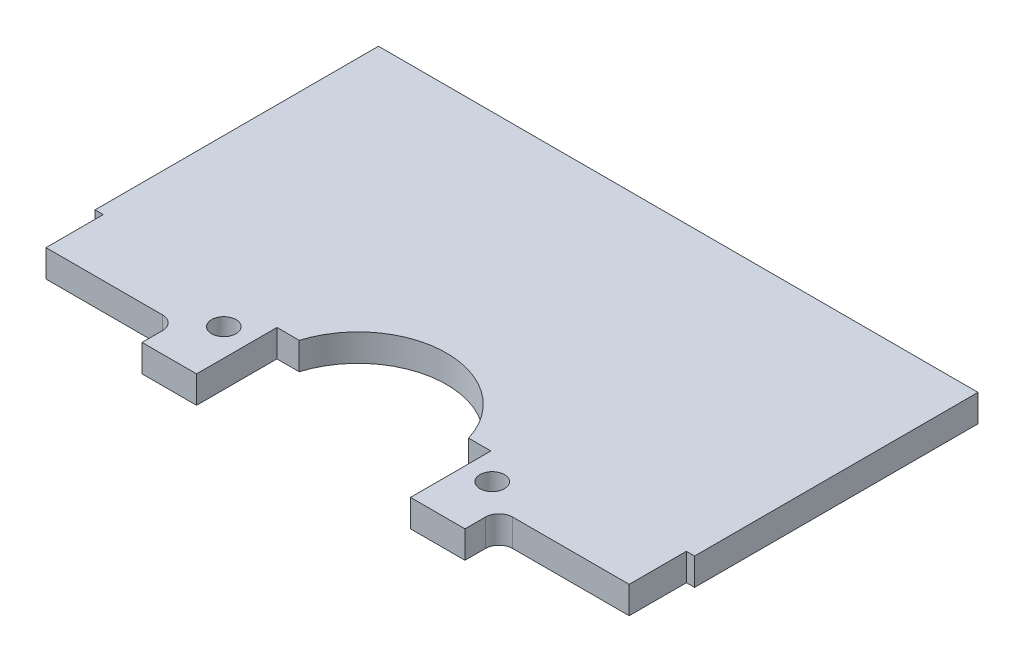
from build123d import *

# Parameters (mm, degrees)
SKETCH1_R           = 1.143
BOSS_EXTRUDE1_DEPTH = 2.54
FILLET1_R           = 1.27


with BuildPart() as part:
    # Sketch1 → Boss-Extrude1 (new body)
    with BuildSketch(Plane(origin=(0, 0, 0), x_dir=(1, 0, 0), z_dir=(0, 1, 0))):
        with BuildLine():
            Line((-27.94, 13.208), (-27.94, -13.208))
            Line((-27.94, -13.208), (-27.178, -13.208))
            Line((-27.178, -13.208), (-27.178, -18.542))
            Line((-27.178, -18.542), (-15.0495, -18.542))
            Line((-15.0495, -18.542), (-15.0495, -21.717))
            Line((-15.0495, -21.717), (-9.9695, -21.717))
            Line((-9.9695, -21.717), (-9.9695, -14.224))
            Line((-9.9695, -14.224), (-7.894457296, -14.224))
            ThreePointArc((-7.894457296, -14.224), (0, -8.382), (7.894457296, -14.224))
            Line((7.894457296, -14.224), (9.9695, -14.224))
            Line((9.9695, -14.224), (9.9695, -21.717))
            Line((9.9695, -21.717), (15.0495, -21.717))
            Line((15.0495, -21.717), (15.0495, -18.542))
            Line((15.0495, -18.542), (27.178, -18.542))
            Line((27.178, -18.542), (27.178, -13.208))
            Line((27.178, -13.208), (27.94, -13.208))
            Line((27.94, -13.208), (27.94, 13.208))
            Line((27.94, 13.208), (-27.94, 13.208))
        make_face()
        with Locations((12.5095, -16.637)):
            Circle(SKETCH1_R, mode=Mode.SUBTRACT)
        with Locations((-12.5095, -16.637)):
            Circle(SKETCH1_R, mode=Mode.SUBTRACT)
    extrude(amount=BOSS_EXTRUDE1_DEPTH)

    # Fillet1
    fillet1_edges = [part.edges().sort_by_distance(p)[0] for p in [
        (-15.0495, 1.27, 18.542),
        (15.0495, 1.27, 18.542),
    ]]
    fillet(fillet1_edges, radius=FILLET1_R)


solid = part.part
